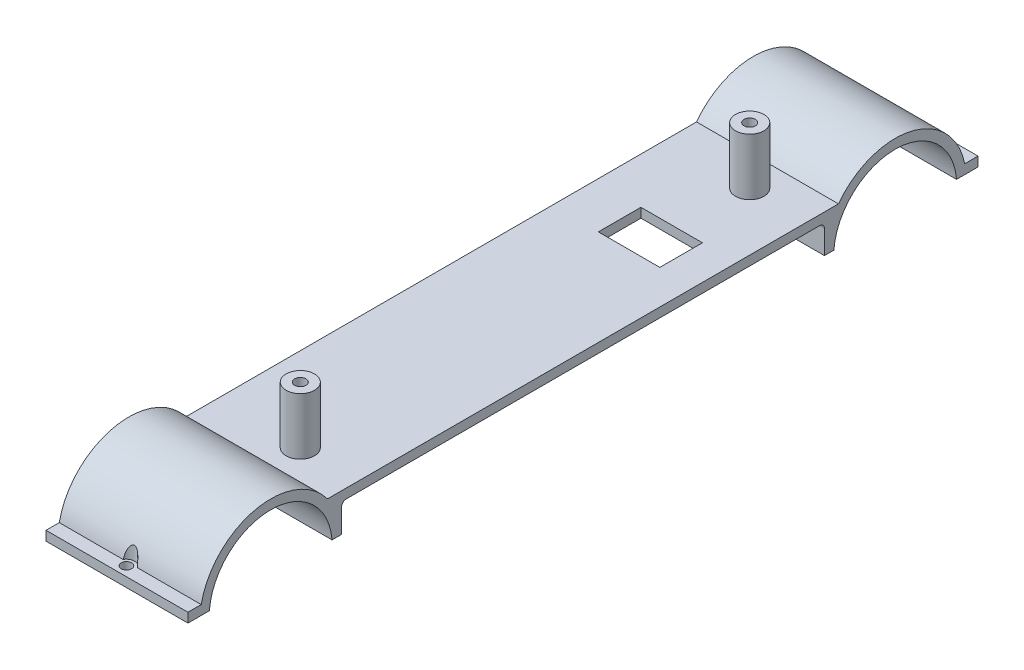
from build123d import *

# Parameters (mm, degrees)
EXTRUDE_1_DEPTH      = 15
EXTRUDE_1_DEPTH_BACK = 15
FILLET_4_R           = 1
SKETCH_2_R           = 1.1
CUT_EXTRUDE_1_DEPTH  = 10
SKETCH_3_R           = 1.703478165
CUT_EXTRUDE_2_DEPTH  = 10
SKETCH_4_R           = 3
EXTRUDE_2_DEPTH      = 12
SKETCH_5_R           = 1.2
CUT_EXTRUDE_3_DEPTH  = 8
SKETCH_6_W           = 13
SKETCH_6_H           = 9
CUT_EXTRUDE_4_DEPTH  = 6


with BuildPart() as part:
    # Эскиз1 → Бобышка-Вытянуть1 (new, two sides: drawn at the far end of the back side and taken through both)
    with BuildSketch(Plane(origin=(0, 0, 0), x_dir=(0, 0, -1), z_dir=(1, 0, 0)).offset(-EXTRUDE_1_DEPTH_BACK)):
        with BuildLine():
            Line((-83.5, 3), (-83.5, 1))
            Line((-83.5, 1), (-78.961481397, 1))
            ThreePointArc((-78.961481397, 1), (-66, 13), (-53.038518603, 1))
            Line((-53.038518603, 1), (-51.038518603, 1))
            Line((-51.038518603, 1), (-51.038518603, 7))
            Line((-51.038518603, 7), (51.038518603, 7))
            Line((51.038518603, 7), (51.038518603, 1))
            Line((51.038518603, 1), (53.038518603, 1))
            ThreePointArc((53.038518603, 1), (66, 13), (78.961481397, 1))
            Line((78.961481397, 1), (83.5, 1))
            Line((83.5, 1), (83.5, 3))
            Line((83.5, 3), (80.696938457, 3))
            ThreePointArc((80.696938457, 3), (69.289128952, 14.634945533), (54, 9))
            Line((54, 9), (-54, 9))
            ThreePointArc((-54, 9), (-69.289128952, 14.634945533), (-80.696938457, 3))
            Line((-80.696938457, 3), (-83.5, 3))
        make_face()
    extrude(amount=EXTRUDE_1_DEPTH + EXTRUDE_1_DEPTH_BACK)

    # Скругление4
    fillet_4_edges = [part.edges().sort_by_distance(p)[0] for p in [
        (0, 7, -51.038518603),
        (0, 7, 51.038518603),
    ]]
    fillet(fillet_4_edges, radius=FILLET_4_R)

    # Эскиз2 → Вырез-Вытянуть1 (cut, symmetric)
    with BuildSketch(Plane(origin=(0, 3, 0), x_dir=(1, 0, 0), z_dir=(0, 1, 0))):
        with Locations((0, 81.5)):
            Circle(SKETCH_2_R)
    cut_extrude_1 = extrude(amount=CUT_EXTRUDE_1_DEPTH, both=True, mode=Mode.SUBTRACT)

    # Эскиз3 → Вырез-Вытянуть2 (cut)
    with BuildSketch(Plane(origin=(0, 3, 0), x_dir=(1, 0, 0), z_dir=(0, 1, 0))):
        with Locations((0, 81.5)):
            Circle(SKETCH_3_R)
    cut_extrude_2 = extrude(amount=CUT_EXTRUDE_2_DEPTH, mode=Mode.SUBTRACT)

    # Зеркальное отражение1: Вырез-Вытянуть1, Вырез-Вытянуть2 across plane
    add(cut_extrude_1.mirror(Plane.XY), mode=Mode.SUBTRACT)
    add(cut_extrude_2.mirror(Plane.XY), mode=Mode.SUBTRACT)

    # Эскиз4 → Бобышка-Вытянуть2 (add)
    with BuildSketch(Plane(origin=(0, 9, 0), x_dir=(1, 0, 0), z_dir=(0, 1, 0))):
        with Locations((2.75, 47.5)):
            Circle(SKETCH_4_R)
        with Locations((2.75, -47.5)):
            Circle(SKETCH_4_R)
    extrude(amount=EXTRUDE_2_DEPTH)

    # Эскиз5 → Вырез-Вытянуть3 (cut)
    with BuildSketch(Plane(origin=(0, 21, 0), x_dir=(1, 0, 0), z_dir=(0, 1, 0))):
        with Locations((2.75, 47.5)):
            Circle(SKETCH_5_R)
        with Locations((2.75, -47.5)):
            Circle(SKETCH_5_R)
    extrude(amount=-CUT_EXTRUDE_3_DEPTH, mode=Mode.SUBTRACT)

    # Эскиз6 → Вырез-Вытянуть4 (cut)
    with BuildSketch(Plane(origin=(0, 9, 0), x_dir=(1, 0, 0), z_dir=(0, 1, 0))):
        with Locations((1.25, 28)):
            Rectangle(SKETCH_6_W, SKETCH_6_H)
    extrude(amount=-CUT_EXTRUDE_4_DEPTH, mode=Mode.SUBTRACT)


solid = part.part
